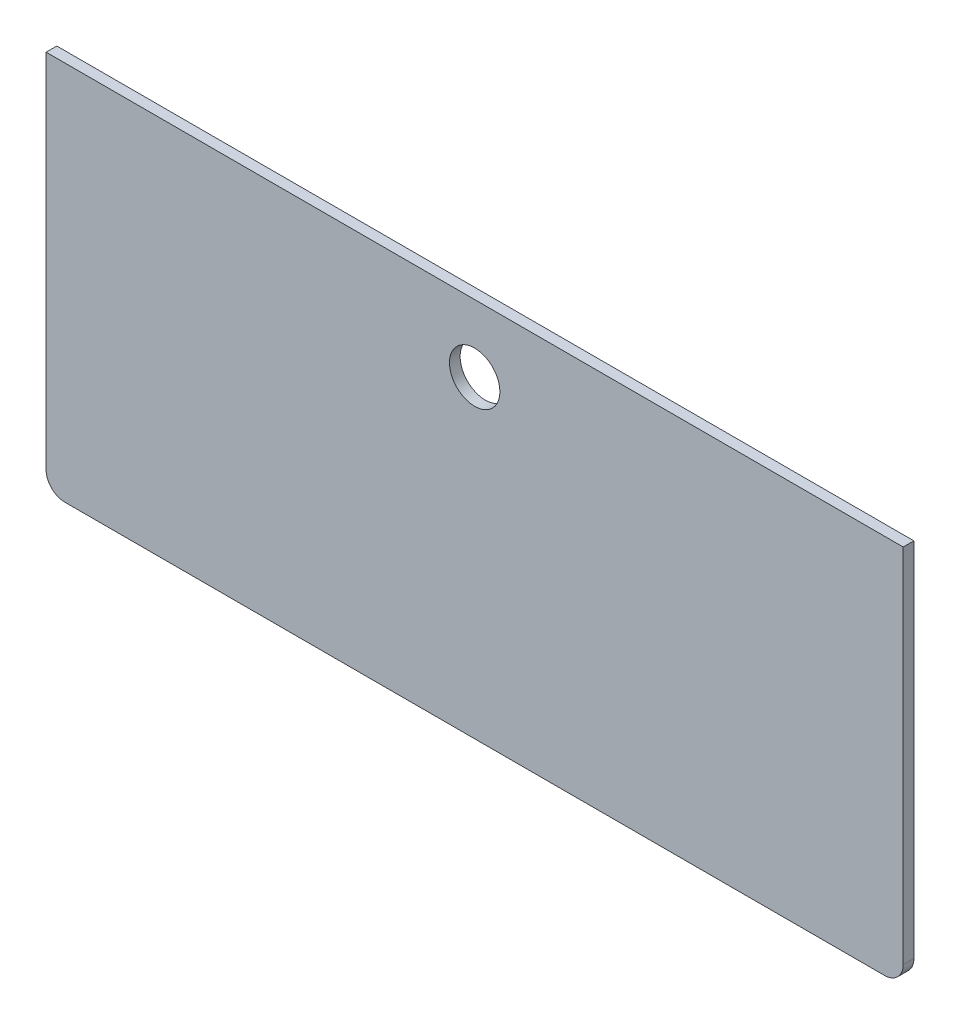
from build123d import *

# Parameters (mm, degrees)
SKETCH1_W           = 255
SKETCH1_H           = 113.175
SKETCH1_R           = 7.5
BOSS_EXTRUDE1_DEPTH = 3.175
FILLET1_R           = 5.55625


with BuildPart() as part:
    # Sketch1 → Boss-Extrude1 (new body)
    with BuildSketch(Plane.XY):
        with Locations((-24.265375854, -29.400711845)):
            Rectangle(SKETCH1_W, SKETCH1_H)
        with Locations((-24.265375854, 7.186788155)):
            Circle(SKETCH1_R, mode=Mode.SUBTRACT)
    extrude(amount=BOSS_EXTRUDE1_DEPTH)

    # Fillet1
    fillet1_edges = [part.edges().sort_by_distance(p)[0] for p in [
        (-151.765375854, -85.988211845, 1.5875),
        (103.234624146, -85.988211845, 1.5875),
    ]]
    fillet(fillet1_edges, radius=FILLET1_R)


solid = part.part
